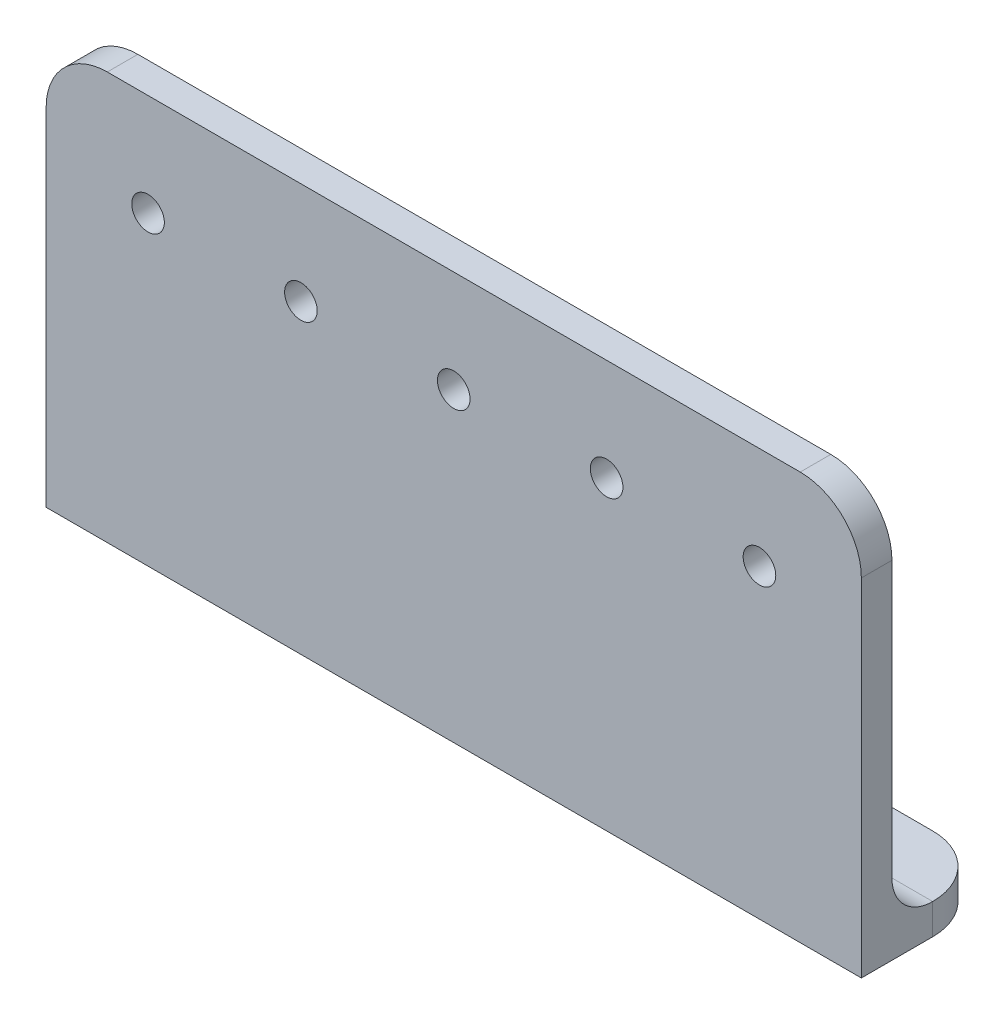
from build123d import *

# Parameters (mm, degrees)
SKETCH1_W           = 80
SKETCH1_H           = 40
BOSS_EXTRUDE1_DEPTH = 3
SKETCH2_R           = 1.6
CUT_EXTRUDE1_DEPTH  = 90.493016487
SKETCH3_W           = 80
SKETCH3_H           = 3
BOSS_EXTRUDE2_DEPTH = 10
SKETCH4_R           = 1.6
CUT_EXTRUDE2_DEPTH  = 89.707384135
FILLET1_R           = 4
FILLET2_R           = 6


with BuildPart() as part:
    # Sketch1 → Boss-Extrude1 (new body)
    with BuildSketch(Plane.XY):
        with Locations((40, 20)):
            Rectangle(SKETCH1_W, SKETCH1_H)
    extrude(amount=BOSS_EXTRUDE1_DEPTH)

    # Sketch2 → Cut-Extrude1 (cut, through all)
    with BuildSketch(Plane.XY.offset(3)):
        with Locations((10, 30)):
            Circle(SKETCH2_R)
        with Locations((25, 30)):
            Circle(SKETCH2_R)
        with Locations((40, 30)):
            Circle(SKETCH2_R)
        with Locations((55, 30)):
            Circle(SKETCH2_R)
        with Locations((70, 30)):
            Circle(SKETCH2_R)
    extrude(amount=-CUT_EXTRUDE1_DEPTH, mode=Mode.SUBTRACT)

    # Sketch3 → Boss-Extrude2 (add)
    with BuildSketch(Plane(origin=(0, 0, 0), x_dir=(-1, 0, 0), z_dir=(0, 0, -1))):
        with Locations((-40, 1.5)):
            Rectangle(SKETCH3_W, SKETCH3_H)
    extrude(amount=BOSS_EXTRUDE2_DEPTH)

    # Sketch4 → Cut-Extrude2 (cut, through all)
    with BuildSketch(Plane(origin=(0, 3, 0), x_dir=(1, 0, 0), z_dir=(0, 1, 0))):
        with Locations((70, 7)):
            Circle(SKETCH4_R)
        with Locations((55, 7)):
            Circle(SKETCH4_R)
        with Locations((40, 7)):
            Circle(SKETCH4_R)
        with Locations((25, 7)):
            Circle(SKETCH4_R)
        with Locations((10, 7)):
            Circle(SKETCH4_R)
    extrude(amount=-CUT_EXTRUDE2_DEPTH, mode=Mode.SUBTRACT)

    # Fillet1
    fillet1_edges = [part.edges().sort_by_distance(p)[0] for p in [
        (40, 3, 0),
    ]]
    fillet(fillet1_edges, radius=FILLET1_R)

    # Fillet2
    fillet2_edges = [part.edges().sort_by_distance(p)[0] for p in [
        (80, 40, 1.5),
        (0, 40, 1.5),
        (0, 1.5, -10),
        (80, 1.5, -10),
    ]]
    fillet(fillet2_edges, radius=FILLET2_R)


solid = part.part
